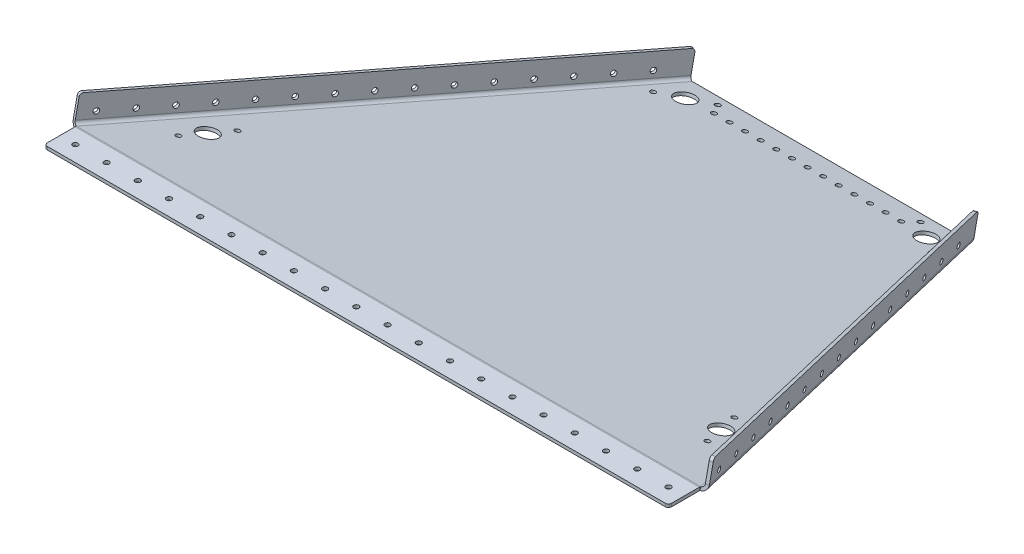
from build123d import *

# Parameters (mm, degrees)
BOSS_EXTRUDE1_DEPTH             = 254
CONVERT_SOLID1_START            = -254
CONVERT_SOLID1_DEPTH            = 508
CONVERT_SOLID1_2_DEPTH          = 508
CUT_EXTRUDE1_DEPTH              = 574.396643949
EDGE_FLANGE1_DEPTH              = 393.117270957
EDGE_FLANGE1_BEND_DEPTH         = 393.117270957
SKETCH12_R                      = 7.9375
CUT_EXTRUDE2_DEPTH              = 580.286449316
F_1_4_0_25_DIAMETER_HOLE1_D     = 4.191
F_1_4_0_25_DIAMETER_HOLE1_DEPTH = 254
F_1_4_0_25_DIAMETER_HOLE1_TIP   = 1.259103427
F_1_4_0_25_DIAMETER_HOLE2_D     = 4.191
F_1_4_0_25_DIAMETER_HOLE2_DEPTH = 254
F_1_4_0_25_DIAMETER_HOLE2_TIP   = 1.259103427
F_1_4_0_25_DIAMETER_HOLE3_D     = 4.191
F_1_4_0_25_DIAMETER_HOLE3_DEPTH = 254
F_1_4_0_25_DIAMETER_HOLE3_TIP   = 1.259103427
F_1_4_0_25_DIAMETER_HOLE5_D     = 4.191
F_1_4_0_25_DIAMETER_HOLE5_DEPTH = 254
F_1_4_0_25_DIAMETER_HOLE5_TIP   = 1.259103427
SKETCH25_R                      = 2.0955
CUT_EXTRUDE3_DEPTH              = 2.54
FILLET1_R                       = 2.54


# Read off the part's stored shape, not the designer's step: Convert-Solid1
# Sheet-metal steps are written as plain solids
with BuildPart() as part:
    # Sketch3 → Boss-Extrude1 (new, symmetric)
    with BuildSketch(Plane(origin=(0, 0, 0), x_dir=(0, 0, -1), z_dir=(1, 0, 0))):
        Polygon((-477.990419123, 101.6), (-503.390419123, 101.6), (-503.390419123, 104.14), (-477.723454365, 104.14), (-118.969509086, 27.884494906), (-119.497604781, 25.4), align=None)
    extrude(amount=BOSS_EXTRUDE1_DEPTH, both=True)

    # Convert-Solid1 outline → Convert-Solid1 (cut)
    with BuildSketch(Plane.YZ.offset(CONVERT_SOLID1_START)):
        with BuildLine():
            Line((104.14, 477.723454365), (104.14, 478.257383881))
            ThreePointArc((104.14, 478.257383881), (104.112171228, 477.726379287), (104.028989812, 477.201192491))
            Line((104.028989812, 477.201192491), (104.14, 477.723454365))
        make_face()
    extrude(amount=CONVERT_SOLID1_DEPTH, mode=Mode.SUBTRACT)

    # Convert-Solid1 2 outline → Convert-Solid1 2 (add)
    with BuildSketch(Plane.YZ.offset(CONVERT_SOLID1_START)):
        with BuildLine():
            Line((101.6, 477.990419123), (101.6, 478.257383881))
            ThreePointArc((101.6, 478.257383881), (101.586085614, 477.991881584), (101.544494906, 477.729288186))
            Line((101.544494906, 477.729288186), (101.6, 477.990419123))
        make_face()
    extrude(amount=CONVERT_SOLID1_2_DEPTH)

    # Sketch8 → Cut-Extrude1 (cut, through all)
    with BuildSketch(Plane(origin=(0, 2.484494906, -0.528095695), x_dir=(1, 0, 0), z_dir=(0, 0.978147600733807, -0.20791169081775257))):
        Polygon((254, -488.402044668), (111.125, -122.167252357), (254, -122.167252357), align=None)
        Polygon((-111.125, -122.167252357), (-254, -488.402044668), (-254, -122.167252357), align=None)
    extrude(amount=-CUT_EXTRUDE1_DEPTH, mode=Mode.SUBTRACT)

    # Edge-Flange1 section (across the edge) → Edge-Flange1 (add)
    with BuildSketch(Plane(origin=(256.366307566, 103.837058096, 476.298224762), x_dir=(-0.9316171518495571, 0.07556366768945466, 0.3554991061944279), z_dir=(-0.36344116770079793, -0.19369409723586034, -0.9112590818841071))):
        with BuildLine():
            Line((-2.54, 2.54), (-2.54, 20.32))
            Line((-2.54, 20.32), (0, 20.32))
            Line((0, 20.32), (0, 2.54))
            ThreePointArc((0, 2.54), (0.743948776, 0.743948776), (2.54, 0))
            Line((2.54, 0), (2.54, -2.54))
            ThreePointArc((2.54, -2.54), (-1.052102448, -1.052102448), (-2.54, 2.54))
        make_face()
    extrude(amount=EDGE_FLANGE1_DEPTH)

    # Edge-Flange1 section 2 (across the edge) → Edge-Flange1 bend (add)
    with BuildSketch(Plane(origin=(-113.491307566, 27.69256319, 118.066541356), x_dir=(0.9316171518495615, 0.07556366768945232, 0.35549910619441694), z_dir=(-0.3634411677007866, 0.19369409723586137, 0.9112590818841114))):
        with BuildLine():
            Line((-2.54, 2.54), (-2.54, 20.32))
            Line((-2.54, 20.32), (0, 20.32))
            Line((0, 20.32), (0, 2.54))
            ThreePointArc((0, 2.54), (0.743948776, 0.743948776), (2.54, 0))
            Line((2.54, 0), (2.54, -2.54))
            ThreePointArc((2.54, -2.54), (-1.052102448, -1.052102448), (-2.54, 2.54))
        make_face()
    extrude(amount=EDGE_FLANGE1_BEND_DEPTH)

    # Sketch12 → Cut-Extrude2 (cut, symmetric)
    with BuildSketch(Plane(origin=(0, 2.484494906, -0.528095695), x_dir=(1, 0, 0), z_dir=(0, 0.978147600733807, -0.20791169081775257))):
        with Locations(Location((208.885313066, -425.17416024, 0), (0, 0, 90))):
            Circle(SKETCH12_R)
        with Locations(Location((98.108445151, -141.217252357, 0), (0, 0, 90))):
            Circle(SKETCH12_R)
    cut_extrude2 = extrude(amount=CUT_EXTRUDE2_DEPTH, both=True, mode=Mode.SUBTRACT)

    # Mirror8: Cut-Extrude2 across plane
    add(cut_extrude2.mirror(Plane(origin=(0, 0, 0), x_dir=(0, 0, 1), z_dir=(1, 0, 0))), mode=Mode.SUBTRACT)

    # 1/4 (0.25) Diameter Hole1
    with Locations(Plane(origin=(0, 104.14, 0), x_dir=(1, 0, 0), z_dir=(0, 1, 0))):
        with Locations((-241.3, -490.690419123), (-215.9, -490.690419123), (-190.5, -490.690419123), (-165.1, -490.690419123), (-139.7, -490.690419123), (-114.3, -490.690419123), (-88.9, -490.690419123), (-63.5, -490.690419123), (-38.1, -490.690419123), (-12.7, -490.690419123), (12.7, -490.690419123), (38.1, -490.690419123), (63.5, -490.690419123), (88.9, -490.690419123), (114.3, -490.690419123), (139.7, -490.690419123), (165.1, -490.690419123), (190.5, -490.690419123), (215.9, -490.690419123), (241.3, -490.690419123), (266.7, -490.690419123)):
            Hole(F_1_4_0_25_DIAMETER_HOLE1_D / 2, depth=F_1_4_0_25_DIAMETER_HOLE1_DEPTH)
            with Locations((0, 0, -(F_1_4_0_25_DIAMETER_HOLE1_DEPTH + F_1_4_0_25_DIAMETER_HOLE1_TIP / 2))):  # 118° drill point
                Cone(0, F_1_4_0_25_DIAMETER_HOLE1_D / 2, F_1_4_0_25_DIAMETER_HOLE1_TIP, mode=Mode.SUBTRACT)

    # 1/4 (0.25) Diameter Hole2
    with Locations(Plane(origin=(59.814802644, -4.851591516, -22.824943524), x_dir=(-0.35412064344222605, 0.031373259319903056, -0.9346733592478765), z_dir=(0.9316171518495572, -0.07556366768945416, -0.3554991061944278))):
        with Locations((-518.621219682, 130.197638553), (-493.872607959, 124.482201754), (-469.123996237, 118.766764955), (-444.375384514, 113.051328156), (-419.626772792, 107.335891357), (-394.878161069, 101.620454558), (-370.129549346, 95.905017759), (-345.380937624, 90.18958096), (-320.632325901, 84.474144161), (-295.883714179, 78.758707362), (-271.135102456, 73.043270563), (-246.386490734, 67.327833764), (-221.637879011, 61.612396964), (-196.889267288, 55.896960165), (-172.140655566, 50.181523366)):
            Hole(F_1_4_0_25_DIAMETER_HOLE2_D / 2, depth=F_1_4_0_25_DIAMETER_HOLE2_DEPTH)
            with Locations((0, 0, -(F_1_4_0_25_DIAMETER_HOLE2_DEPTH + F_1_4_0_25_DIAMETER_HOLE2_TIP / 2))):  # 118° drill point
                Cone(0, F_1_4_0_25_DIAMETER_HOLE2_D / 2, F_1_4_0_25_DIAMETER_HOLE2_TIP, mode=Mode.SUBTRACT)

    # 1/4 (0.25) Diameter Hole3
    with Locations(Plane(origin=(-59.814802644, -4.851591516, -22.824943524), x_dir=(-0.3541206434422149, -0.03137325931990071, 0.9346733592478808), z_dir=(-0.9316171518495615, -0.07556366768945355, -0.3554991061944165))):
        with Locations((518.621219682, 130.197638553), (493.872607959, 124.482201754), (469.123996237, 118.766764955), (444.375384514, 113.051328156), (419.626772792, 107.335891357), (394.878161069, 101.620454558), (370.129549346, 95.905017759), (345.380937624, 90.18958096), (320.632325901, 84.474144161), (295.883714179, 78.758707362), (271.135102456, 73.043270563), (246.386490734, 67.327833764), (221.637879011, 61.612396964), (196.889267288, 55.896960165), (172.140655566, 50.181523366)):
            Hole(F_1_4_0_25_DIAMETER_HOLE3_D / 2, depth=F_1_4_0_25_DIAMETER_HOLE3_DEPTH)
            with Locations((0, 0, -(F_1_4_0_25_DIAMETER_HOLE3_DEPTH + F_1_4_0_25_DIAMETER_HOLE3_TIP / 2))):  # 118° drill point
                Cone(0, F_1_4_0_25_DIAMETER_HOLE3_D / 2, F_1_4_0_25_DIAMETER_HOLE3_TIP, mode=Mode.SUBTRACT)

    # 1/4 (0.25) Diameter Hole5
    with Locations(Plane(origin=(0, 2.484494906, -0.528095695), x_dir=(1, 0, 0), z_dir=(0, 0.9781476007338071, -0.2079116908177526))):
        with Locations((76.2, -139.814560704), (63.5, -139.814560704), (50.8, -139.814560704), (38.1, -139.814560704), (25.4, -139.814560704), (12.7, -139.814560704), (0, -139.814560704), (-12.7, -139.814560704), (-25.4, -139.814560704), (-38.1, -139.814560704), (-50.8, -139.814560704), (-63.5, -139.814560704), (-76.2, -139.814560704)):
            Hole(F_1_4_0_25_DIAMETER_HOLE5_D / 2, depth=F_1_4_0_25_DIAMETER_HOLE5_DEPTH)
            with Locations((0, 0, -(F_1_4_0_25_DIAMETER_HOLE5_DEPTH + F_1_4_0_25_DIAMETER_HOLE5_TIP / 2))):  # 118° drill point
                Cone(0, F_1_4_0_25_DIAMETER_HOLE5_D / 2, F_1_4_0_25_DIAMETER_HOLE5_TIP, mode=Mode.SUBTRACT)

    # Sketch25 → Cut-Extrude3 (cut)
    with BuildSketch(Plane(origin=(0, 2.484494906, -0.528095695), x_dir=(1, 0, 0), z_dir=(0, 0.9781476007338071, -0.2079116908177526))):
        with Locations(Location((-215.248775979, -443.13558852, 0), (0, 0, 270))):
            Circle(SKETCH25_R)
        with Locations(Location((-202.139295591, -407.361973607, 0), (0, 0, 270))):
            Circle(SKETCH25_R)
        with Locations(Location((-113.372717488, -152.428680891, 0), (0, 0, 270))):
            Circle(SKETCH25_R)
        with Locations(Location((-82.461618252, -130.155065468, 0), (0, 0, 270))):
            Circle(SKETCH25_R)
    cut_extrude3 = extrude(amount=-CUT_EXTRUDE3_DEPTH, mode=Mode.SUBTRACT)

    # Mirror9: Cut-Extrude3 across plane
    add(cut_extrude3.mirror(Plane(origin=(0, 0, 0), x_dir=(0, 0, 1), z_dir=(1, 0, 0))), mode=Mode.SUBTRACT)

    # Fillet1
    fillet1_edges = [part.edges().sort_by_distance(p)[0] for p in [
        (254, 102.87, 503.390419123),
        (-254, 102.87, 503.390419123),
        (257.549461349, 123.617051485, 471.621975339),
        (114.674461349, 47.472556579, 113.390291934),
        (-114.674461349, 47.472556579, 113.390291934),
        (-257.549461349, 123.617051485, 471.621975339),
    ]]
    fillet(fillet1_edges, radius=FILLET1_R)


solid = part.part
